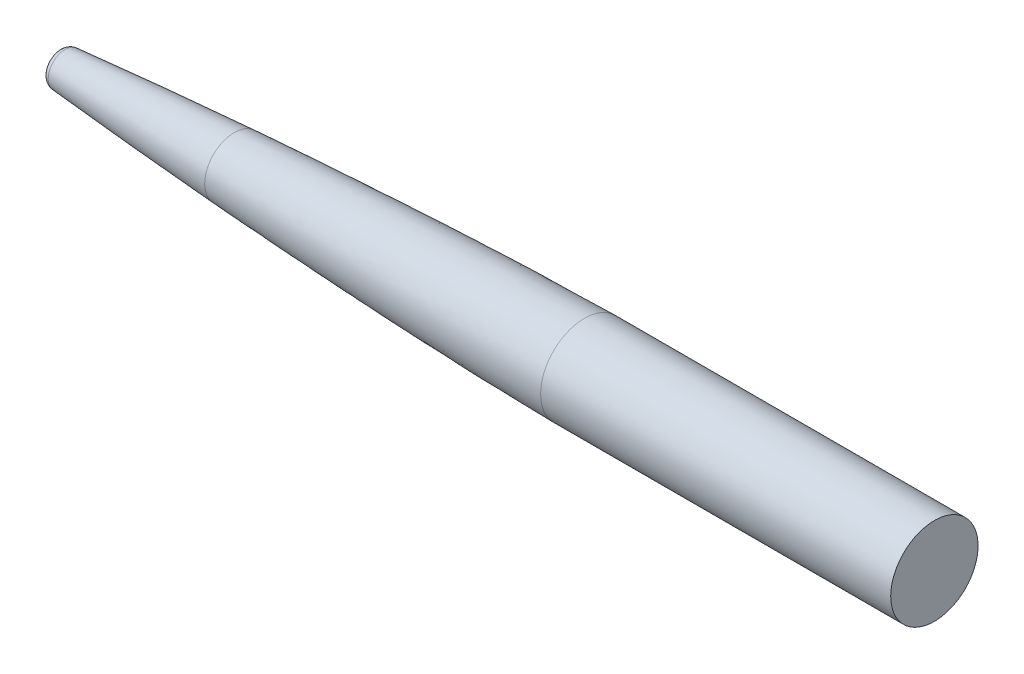
from build123d import *

# Parameters (mm, degrees)
FILLET1_R           = 3.81
SPLIT2_START        = 76.2
SPLIT2_2_OUTLINE_W  = 54
SPLIT2_2_OUTLINE_H  = 54
SPLIT2_2_DEPTH      = 304.8
SKETCH2_R           = 6.35
BOSS_EXTRUDE1_DEPTH = 12.7
SKETCH3_R           = 6.4135
CUT_EXTRUDE1_DEPTH  = 13.97
FILLET2_R           = 1.27
SKETCH4_R           = 6.35
BOSS_EXTRUDE2_DEPTH = 12.7
SKETCH5_R           = 6.4135
CUT_EXTRUDE2_DEPTH  = 13.97
FILLET3_R           = 1.27


# Read off the part's stored shape, not the designer's step: Split2
with BuildPart() as part:
    # Sketch1 → Revolve1 (revolve)
    with BuildSketch(Plane.XY, mode=Mode.PRIVATE) as revolve1_sk:
        with BuildLine():
            Line((381, 25.3619), (584.2, 25.3619))
            Line((584.2, 25.3619), (584.2, 0))
            Line((584.2, 0), (0, 0))
            add(Edge.make_bspline(
                [(0, 0), (0.001943702, 0.003241862), (0.006389673, 0.009245617), (0.017681717, 0.019205878), (0.042272918, 0.036450053), (0.077894833, 0.057232573), (0.124712659, 0.080973851), (0.191250301, 0.111419343), (0.271031854, 0.144556968), (0.391244533, 0.190542862), (0.570742032, 0.252932933), (0.832821896, 0.335886963), (1.260370277, 0.458588114), (1.983412651, 0.645281043), (3.281149014, 0.942604321), (5.70557572, 1.428684819), (10.274937833, 2.220001642), (18.491155359, 3.437695386), (31.841085113, 5.129912275), (49.748145394, 7.088974906), (71.111079528, 9.154217125), (94.269940572, 11.168396588), (117.44296568, 13.011191187), (140.626874096, 14.711091291), (163.819588974, 16.285839147), (187.019770429, 17.746317083), (210.226471113, 19.099066483), (239.242169499, 20.659360719), (268.266826454, 22.045635859), (297.299602619, 23.251440617), (326.340171249, 24.24885616), (346.242443602, 24.805833209), (362.812607625, 25.161527082), (373.573934486, 25.312112889), (378.524593559, 25.356098005), (381, 25.3619)],
                knots=[0, 0, 0, 0, 0, 3.9223e-05, 7.8447e-05, 0.000156893, 0.000313787, 0.00047068, 0.000627573, 0.00092271, 0.001217847, 0.001817723, 0.002616351, 0.003799706, 0.00587318, 0.00963319, 0.016550169, 0.029678503, 0.05440813, 0.096565321, 0.157394895, 0.21822447, 0.279054044, 0.339883618, 0.400713193, 0.461542767, 0.522372341, 0.583201916, 0.64403149, 0.765690639, 0.826520214, 0.887349788, 0.948179362, 0.974089681, 1, 1, 1, 1, 1], degree=4))
        make_face()
    revolve(revolve1_sk.sketch.rotate(Axis((0, 0, 0), (1, 0, 0)), 90), axis=Axis((0, 0, 0), (1, 0, 0)))

    # Split1
    split(bisect_by=Plane(origin=(76.2, 0, 0), x_dir=(0, 0, 1), z_dir=(1, 0, 0)), keep=Keep.TOP)

    # Fillet1
    fillet1_edges = [part.edges().sort_by_distance(p)[0] for p in [
        (76.2, -1e-09, -9.569835462),
    ]]
    fillet(fillet1_edges, radius=FILLET1_R)

    # Split2 2 outline → Split2 2 (cut)
    with BuildSketch(Plane.YZ.offset(SPLIT2_START)):
        Rectangle(SPLIT2_2_OUTLINE_W, SPLIT2_2_OUTLINE_H)
    extrude(amount=SPLIT2_2_DEPTH, mode=Mode.SUBTRACT)

    # Sketch2 → Boss-Extrude1 (add)
    with BuildSketch(Plane.ZY.offset(-381)):
        Circle(SKETCH2_R)
    extrude(amount=BOSS_EXTRUDE1_DEPTH)


with BuildPart() as body_2:
    # Split2 outline → Split2 (revolve)
    with BuildSketch(Plane.YX):
        with BuildLine():
            Line((0, 177.8), (0, 76.2))
            Line((0, 76.2), (6.084420139, 76.2))
            ThreePointArc((6.084420139, 76.2), (8.657032806, 77.199703919), (9.879592473, 79.674192093))
            add(Edge.make_bspline(
                [(17.156163156, 177.8), (17.118974817, 177.205056497), (16.718192411, 170.809994021), (15.932533919, 158.616148073), (14.711091291, 140.626874096), (13.011191187, 117.44296568), (11.569057582, 99.30822714), (10.522806902, 86.972101563), (9.946344013, 80.42859243), (9.879592473, 79.674192093)],
                knots=[0.532217748, 0.532217748, 0.532217748, 0.532217748, 0.532217748, 0.538457233, 0.599286807, 0.660116382, 0.720945956, 0.78177553, 0.789702762, 0.789702762, 0.789702762, 0.789702762, 0.789702762], degree=4))
            Line((17.156163156, 177.8), (0, 177.8))
        make_face()
    revolve(axis=Axis((0, 0, 0), (1, 0, 0)))

    # Sketch5 → Cut-Extrude2 (cut)
    with BuildSketch(Plane(origin=(177.8, 0, 0), x_dir=(0, 0, -1), z_dir=(1, 0, 0))):
        Circle(SKETCH5_R)
    extrude(amount=-CUT_EXTRUDE2_DEPTH, mode=Mode.SUBTRACT)

    # Fillet3
    fillet3_edges = [body_2.edges().sort_by_distance(p)[0] for p in [
        (177.8, 0, 6.4135),
    ]]
    fillet(fillet3_edges, radius=FILLET3_R)


with BuildPart() as body_3:
    # Split2 3 outline → Split2 3 (revolve)
    with BuildSketch(Plane.YX):
        with BuildLine():
            Line((0, 381), (0, 177.8))
            Line((0, 177.8), (17.156163156, 177.8))
            add(Edge.make_bspline(
                [(25.3619, 381), (25.356098005, 378.524593559), (25.312112889, 373.573934486), (25.161527082, 362.812607625), (24.805833209, 346.242443602), (24.24885616, 326.340171249), (23.251440617, 297.299602619), (22.045635859, 268.266826454), (20.659360719, 239.242169499), (19.131075362, 210.821717791), (18.153790723, 194.011643645), (17.481528925, 183.005240471), (17.156163156, 177.8)],
                knots=[0, 0, 0, 0, 0, 0.025910319, 0.051820638, 0.112650212, 0.173479786, 0.234309361, 0.35596851, 0.416798084, 0.477627659, 0.532217748, 0.532217748, 0.532217748, 0.532217748, 0.532217748], degree=4))
            Line((25.3619, 381), (0, 381))
        make_face()
    revolve(axis=Axis((0, 0, 0), (1, 0, 0)))

    # Sketch3 → Cut-Extrude1 (cut)
    with BuildSketch(Plane(origin=(381, 0, 0), x_dir=(0, 0, -1), z_dir=(1, 0, 0))):
        Circle(SKETCH3_R)
    extrude(amount=-CUT_EXTRUDE1_DEPTH, mode=Mode.SUBTRACT)

    # Fillet2
    fillet2_edges = [body_3.edges().sort_by_distance(p)[0] for p in [
        (381, 0, 6.4135),
    ]]
    fillet(fillet2_edges, radius=FILLET2_R)

    # Sketch4 → Boss-Extrude2 (add)
    with BuildSketch(Plane.ZY.offset(-177.8)):
        Circle(SKETCH4_R)
    extrude(amount=BOSS_EXTRUDE2_DEPTH)


solid = Compound([part.part, body_2.part, body_3.part])
